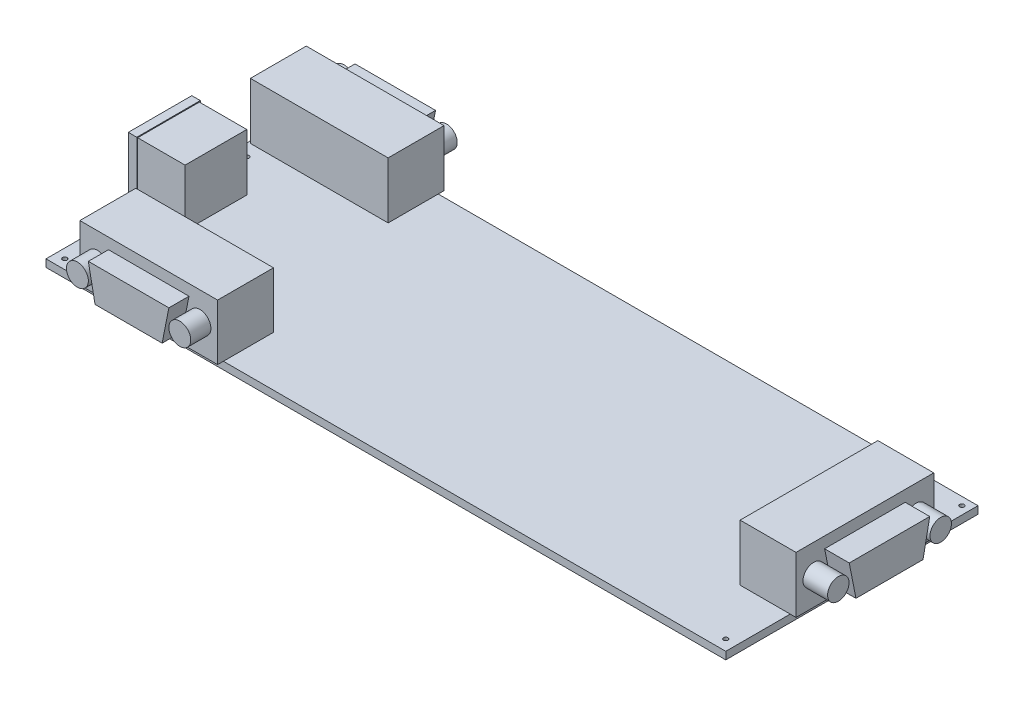
from build123d import *

# Parameters (mm, degrees)
SKETCH1_W            = 152
SKETCH1_H            = 56.4
BOSS_EXTRUDE1_DEPTH  = 1.67
SKETCH3_W            = 12.5
SKETCH3_H            = 30.8
BOSS_EXTRUDE2_DEPTH  = 12.6
SKETCH4_R            = 2.4
BOSS_EXTRUDE3_DEPTH  = 5.5
SKETCH5_W            = 30.8
SKETCH5_H            = 12.5
BOSS_EXTRUDE4_DEPTH  = 12.6
SKETCH6_W            = 30.8
SKETCH6_H            = 12.5
BOSS_EXTRUDE5_DEPTH  = 12.5
SKETCH7_R            = 2.45
BOSS_EXTRUDE6_DEPTH  = 4.5
SKETCH9_R            = 2.4
BOSS_EXTRUDE7_DEPTH  = 4.5
SKETCH10_W           = 10.6
SKETCH10_H           = 13.8
BOSS_EXTRUDE8_DEPTH  = 12.7
SKETCH12_W           = 14.2
SKETCH12_H           = 13.1
BOSS_EXTRUDE9_DEPTH  = 1.9
SKETCH13_W           = 5
SKETCH13_H           = 45.8
BOSS_EXTRUDE10_DEPTH = 2.7
SKETCH14_R           = 0.5
CUT_EXTRUDE1_DEPTH   = 91.433677355


with BuildPart() as part:
    # Sketch1 → Boss-Extrude1 (new body)
    with BuildSketch(Plane(origin=(0, 0, 0), x_dir=(1, 0, 0), z_dir=(0, 1, 0))):
        Rectangle(SKETCH1_W, SKETCH1_H)
    extrude(amount=BOSS_EXTRUDE1_DEPTH)

    # Sketch3 → Boss-Extrude2 (add)
    with BuildSketch(Plane(origin=(0, 1.67, 0), x_dir=(1, 0, 0), z_dir=(0, 1, 0))):
        with Locations((71.05, 1.61)):
            Rectangle(SKETCH3_W, SKETCH3_H)
    extrude(amount=BOSS_EXTRUDE2_DEPTH)

    # Sketch4 → Boss-Extrude3 (add)
    with BuildSketch(Plane(origin=(77.3, 0, 0), x_dir=(0, 0, -1), z_dir=(1, 0, 0))):
        with Locations((-9.84, 7.97)):
            Circle(SKETCH4_R)
        with Locations((13.06, 7.97)):
            Circle(SKETCH4_R)
        Polygon((-7.39, 11.77), (10.61, 11.77), (9.11, 4.17), (-5.89, 4.17), align=None)
    extrude(amount=BOSS_EXTRUDE3_DEPTH)

    # Sketch5 → Boss-Extrude4 (add)
    with BuildSketch(Plane(origin=(0, 1.67, 0), x_dir=(1, 0, 0), z_dir=(0, 1, 0))):
        with Locations((-60.1, 23.25)):
            Rectangle(SKETCH5_W, SKETCH5_H)
    extrude(amount=BOSS_EXTRUDE4_DEPTH)

    # Sketch6 → Boss-Extrude5 (add)
    with BuildSketch(Plane(origin=(0, 1.67, 0), x_dir=(1, 0, 0), z_dir=(0, 1, 0))):
        with Locations((-51.73, -23.25)):
            Rectangle(SKETCH6_W, SKETCH6_H)
    extrude(amount=BOSS_EXTRUDE5_DEPTH)

    # Sketch7 → Boss-Extrude6 (add)
    with BuildSketch(Plane.XY.offset(29.5)):
        with Locations((-63.18, 7.92)):
            Circle(SKETCH7_R)
        with Locations((-40.28, 7.92)):
            Circle(SKETCH7_R)
        Polygon((-60.73, 11.72), (-42.73, 11.72), (-44.23, 4.12), (-59.23, 4.12), align=None)
    extrude(amount=BOSS_EXTRUDE6_DEPTH)

    # Sketch9 → Boss-Extrude7 (add)
    with BuildSketch(Plane(origin=(0, 0, -29.5), x_dir=(-1, 0, 0), z_dir=(0, 0, -1))):
        with Locations((48.65, 7.97)):
            Circle(SKETCH9_R)
        with Locations((71.55, 7.97)):
            Circle(SKETCH9_R)
        Polygon((51.1, 11.77), (69.1, 11.77), (67.6, 4.17), (52.6, 4.17), align=None)
    extrude(amount=BOSS_EXTRUDE7_DEPTH)

    # Sketch10 → Boss-Extrude8 (add)
    with BuildSketch(Plane(origin=(0, 1.67, 0), x_dir=(1, 0, 0), z_dir=(0, 1, 0))):
        with Locations((-71.2, -0.3)):
            Rectangle(SKETCH10_W, SKETCH10_H)
    extrude(amount=BOSS_EXTRUDE8_DEPTH)

    # Sketch12 → Boss-Extrude9 (add)
    with BuildSketch(Plane.ZY.offset(76.5)):
        with Locations((0.3, 8.02)):
            Rectangle(SKETCH12_W, SKETCH12_H)
    extrude(amount=BOSS_EXTRUDE9_DEPTH)

    # Sketch13 → Boss-Extrude10 (add)
    with BuildSketch(Plane.XZ):
        with Locations((34, -2.9)):
            Rectangle(SKETCH13_W, SKETCH13_H)
    extrude(amount=BOSS_EXTRUDE10_DEPTH)

    # Sketch14 → Cut-Extrude1 (cut, through all)
    with BuildSketch(Plane(origin=(0, 1.67, 0), x_dir=(1, 0, 0), z_dir=(0, 1, 0))):
        with Locations((74.2, 26.4)):
            Circle(SKETCH14_R)
        with Locations((73.6, -25.8)):
            Circle(SKETCH14_R)
        with Locations((-73.9, -26.1)):
            Circle(SKETCH14_R)
        with Locations((-73.3, 14)):
            Circle(SKETCH14_R)
    extrude(amount=-CUT_EXTRUDE1_DEPTH, mode=Mode.SUBTRACT)


solid = part.part
